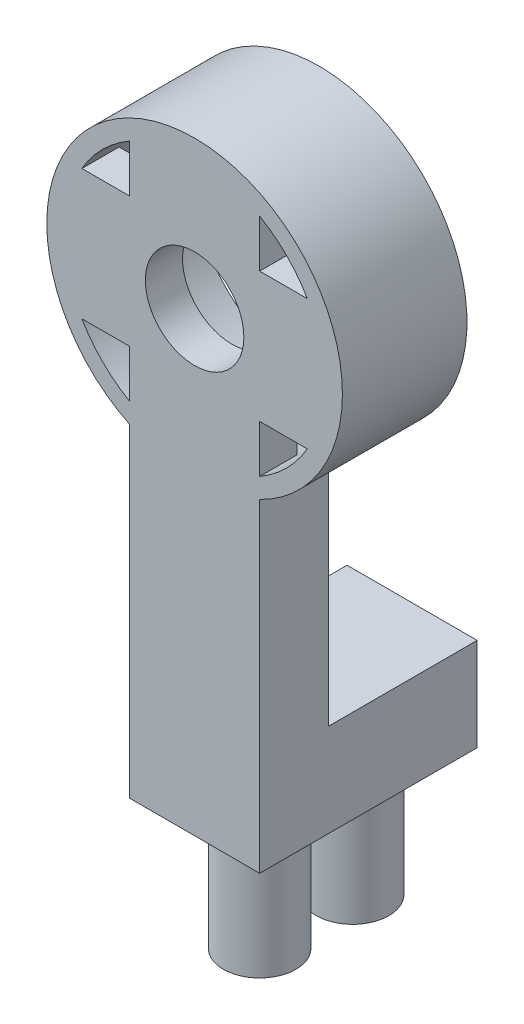
from build123d import *
from build123d.topology import SkipClean

# Parameters (mm, degrees)
SKETCH1_R            = 1.5
BOSS_EXTRUDE4_DEPTH  = 3
BOSS_EXTRUDE5_START  = 3
SKETCH3_R            = 7.95
SKETCH3_R_2          = 1.5
BOSS_EXTRUDE5_DEPTH  = 3
SKETCH4_R            = 2.5
CUT_EXTRUDE1_DEPTH   = 1.5
SKETCH5_R            = 7
CUT_EXTRUDE2_DEPTH   = 4
SKETCH6_R            = 7.95
CUT_EXTRUDE3_DEPTH   = 1
SKETCH7_R            = 2.5
CUT_EXTRUDE4_DEPTH   = 0.5
BOSS_EXTRUDE6_START  = 0.7
SKETCH8_R            = 7.95
SKETCH8_R_2          = 7
BOSS_EXTRUDE6_DEPTH  = 0.7
BOSS_EXTRUDE8_START  = 0.7
SKETCH9_R            = 7.95
SKETCH9_R_2          = 1.5
BOSS_EXTRUDE8_DEPTH  = 0.7
BOSS_EXTRUDE9_START  = 0.7
BOSS_EXTRUDE9_DEPTH  = 0.7
SKETCH15_R           = 7
SKETCH15_R_2         = 4.949747468
BOSS_EXTRUDE12_DEPTH = 5.7
SKETCH16_W           = 7
SKETCH16_H           = 7
CUT_EXTRUDE7_DEPTH   = 5.7
SKETCH17_W           = 21.103619628
SKETCH17_H           = 19.457314619
CUT_EXTRUDE8_DEPTH   = 10
SKETCH18_W           = 7
SKETCH18_H           = 8
BOSS_EXTRUDE13_DEPTH = 5
SKETCH19_R           = 1.95
BOSS_EXTRUDE14_DEPTH = 7
SKETCH20_R           = 2.65
CUT_EXTRUDE9_DEPTH   = 10


with BuildPart() as part:
    # Sketch1 → Boss-Extrude4 (new body)
    with BuildSketch(Plane.XY):
        with BuildLine():
            Line((-3.5, -7.138101989), (-3.5, -27.861898011))
            ThreePointArc((-3.5, -27.861898011), (0, -42.95), (3.5, -27.861898011))
            Line((3.5, -27.861898011), (3.5, -7.138101989))
            ThreePointArc((3.5, -7.138101989), (0, 7.95), (-3.5, -7.138101989))
        make_face()
        with BuildLine():
            Line((-3.5, 6.062177826), (-3.5, 3.5))
            Line((-3.5, 3.5), (-6.062177826, 3.5))
            ThreePointArc((-6.062177826, 3.5), (-4.949747468, 4.949747468), (-3.5, 6.062177826))
        make_face(mode=Mode.SUBTRACT)
        with BuildLine():
            Line((3.5, 3.5), (3.5, 6.062177826))
            ThreePointArc((3.5, 6.062177826), (4.949747468, 4.949747468), (6.062177826, 3.5))
            Line((6.062177826, 3.5), (3.5, 3.5))
        make_face(mode=Mode.SUBTRACT)
        Circle(SKETCH1_R, mode=Mode.SUBTRACT)
        with BuildLine():
            Line((-6.062177826, -3.5), (-3.5, -3.5))
            Line((-3.5, -3.5), (-3.5, -6.062177826))
            ThreePointArc((-3.5, -6.062177826), (-4.949747468, -4.949747468), (-6.062177826, -3.5))
        make_face(mode=Mode.SUBTRACT)
        with BuildLine():
            Line((3.5, -3.5), (6.062177826, -3.5))
            ThreePointArc((6.062177826, -3.5), (4.949747468, -4.949747468), (3.5, -6.062177826))
            Line((3.5, -6.062177826), (3.5, -3.5))
        make_face(mode=Mode.SUBTRACT)
        with BuildLine():
            ThreePointArc((3.5, -28.937822174), (4.949747468, -30.050252532), (6.062177826, -31.5))
            Line((6.062177826, -31.5), (3.5, -31.5))
            Line((3.5, -31.5), (3.5, -28.937822174))
        make_face(mode=Mode.SUBTRACT)
        with BuildLine():
            Line((-3.5, -28.937822174), (-3.5, -31.5))
            Line((-3.5, -31.5), (-6.062177826, -31.5))
            ThreePointArc((-6.062177826, -31.5), (-4.949747468, -30.050252532), (-3.5, -28.937822174))
        make_face(mode=Mode.SUBTRACT)
        with BuildLine():
            ThreePointArc((-3.5, -41.062177826), (-4.949747468, -39.949747468), (-6.062177826, -38.5))
            Line((-6.062177826, -38.5), (-3.5, -38.5))
            Line((-3.5, -38.5), (-3.5, -41.062177826))
        make_face(mode=Mode.SUBTRACT)
        with BuildLine():
            ThreePointArc((6.062177826, -38.5), (4.949747468, -39.949747468), (3.5, -41.062177826))
            Line((3.5, -41.062177826), (3.5, -38.5))
            Line((3.5, -38.5), (6.062177826, -38.5))
        make_face(mode=Mode.SUBTRACT)
        with Locations((0, -35)):
            Circle(SKETCH1_R, mode=Mode.SUBTRACT)
    extrude(amount=BOSS_EXTRUDE4_DEPTH)

    # Sketch3 → Boss-Extrude5 (add)
    # profile 1 of 2: a face of its own
    with SkipClean():  # the faces are left unmerged after this step: merging them gives an invalid solid
        with BuildSketch(Plane(origin=(0, 0, 0), x_dir=(-1, 0, 0), z_dir=(0, 0, -1)).offset(BOSS_EXTRUDE5_START)):
            Circle(SKETCH3_R)
            with BuildLine():
                Line((3.5, 3.5), (3.5, 6.062177826))
                ThreePointArc((3.5, 6.062177826), (4.949747468, 4.949747468), (6.062177826, 3.5))
                Line((6.062177826, 3.5), (3.5, 3.5))
            make_face(mode=Mode.SUBTRACT)
            with BuildLine():
                Line((3.5, -3.5), (6.062177826, -3.5))
                ThreePointArc((6.062177826, -3.5), (4.949747468, -4.949747468), (3.5, -6.062177826))
                Line((3.5, -6.062177826), (3.5, -3.5))
            make_face(mode=Mode.SUBTRACT)
            with BuildLine():
                Line((-3.5, -3.5), (-3.5, -6.062177826))
                ThreePointArc((-3.5, -6.062177826), (-4.949747468, -4.949747468), (-6.062177826, -3.5))
                Line((-6.062177826, -3.5), (-3.5, -3.5))
            make_face(mode=Mode.SUBTRACT)
            with BuildLine():
                Line((-3.5, 3.5), (-6.062177826, 3.5))
                ThreePointArc((-6.062177826, 3.5), (-4.949747468, 4.949747468), (-3.5, 6.062177826))
                Line((-3.5, 6.062177826), (-3.5, 3.5))
            make_face(mode=Mode.SUBTRACT)
            Circle(SKETCH3_R_2, mode=Mode.SUBTRACT)
        # profile 2 of 2: a face of its own
        with BuildSketch(Plane(origin=(0, 0, 0), x_dir=(-1, 0, 0), z_dir=(0, 0, -1)).offset(BOSS_EXTRUDE5_START)):
            with Locations((0, -35)):
                Circle(SKETCH3_R)
            with BuildLine():
                Line((-3.5, -38.5), (-3.5, -41.062177826))
                ThreePointArc((-3.5, -41.062177826), (-4.949747468, -39.949747468), (-6.062177826, -38.5))
                Line((-6.062177826, -38.5), (-3.5, -38.5))
            make_face(mode=Mode.SUBTRACT)
            with BuildLine():
                Line((-3.5, -31.5), (-6.062177826, -31.5))
                ThreePointArc((-6.062177826, -31.5), (-4.949747468, -30.050252532), (-3.5, -28.937822174))
                Line((-3.5, -28.937822174), (-3.5, -31.5))
            make_face(mode=Mode.SUBTRACT)
            with BuildLine():
                Line((3.5, -31.5), (3.5, -28.937822174))
                ThreePointArc((3.5, -28.937822174), (4.949747468, -30.050252532), (6.062177826, -31.5))
                Line((6.062177826, -31.5), (3.5, -31.5))
            make_face(mode=Mode.SUBTRACT)
            with BuildLine():
                Line((3.5, -38.5), (6.062177826, -38.5))
                ThreePointArc((6.062177826, -38.5), (4.949747468, -39.949747468), (3.5, -41.062177826))
                Line((3.5, -41.062177826), (3.5, -38.5))
            make_face(mode=Mode.SUBTRACT)
            with Locations((0, -35)):
                Circle(SKETCH3_R_2, mode=Mode.SUBTRACT)
        extrude(amount=-BOSS_EXTRUDE5_DEPTH)

    # Sketch4 → Cut-Extrude1 (cut)
    with SkipClean():  # the faces are left unmerged after this step: merging them gives an invalid solid
        with BuildSketch(Plane.XY.offset(3)):
            with Locations((0, -35)):
                Circle(SKETCH4_R)
            Circle(SKETCH4_R)
        extrude(amount=-CUT_EXTRUDE1_DEPTH, mode=Mode.SUBTRACT)

    # Sketch5 → Cut-Extrude2 (cut)
    with SkipClean():  # the faces are left unmerged after this step: merging them gives an invalid solid
        with BuildSketch(Plane(origin=(0, 0, -3), x_dir=(-1, 0, 0), z_dir=(0, 0, -1))):
            Circle(SKETCH5_R)
        extrude(amount=-CUT_EXTRUDE2_DEPTH, mode=Mode.SUBTRACT)
    add(part.part.scale(1), mode=Mode.REPLACE)  # the faces are merged on a copy

    # Sketch6 → Cut-Extrude3 (cut)
    with BuildSketch(Plane(origin=(0, 0, -3), x_dir=(-1, 0, 0), z_dir=(0, 0, -1))):
        with Locations((0, -35)):
            Circle(SKETCH6_R)
    extrude(amount=-CUT_EXTRUDE3_DEPTH, mode=Mode.SUBTRACT)

    # Sketch7 → Cut-Extrude4 (cut)
    with BuildSketch(Plane.XY.offset(1.5)):
        with Locations((0, -35)):
            Circle(SKETCH7_R)
    extrude(amount=-CUT_EXTRUDE4_DEPTH, mode=Mode.SUBTRACT)

    # Sketch8 → Boss-Extrude6 (add)
    with BuildSketch(Plane(origin=(0, 0, -3), x_dir=(-1, 0, 0), z_dir=(0, 0, -1)).offset(BOSS_EXTRUDE6_START)):
        Circle(SKETCH8_R)
        Circle(SKETCH8_R_2, mode=Mode.SUBTRACT)
    extrude(amount=-BOSS_EXTRUDE6_DEPTH)

    # Sketch9 → Boss-Extrude8 (add)
    with SkipClean():  # the faces are left unmerged after this step: merging them gives an invalid solid
        with BuildSketch(Plane(origin=(0, 0, -2), x_dir=(-1, 0, 0), z_dir=(0, 0, -1)).offset(BOSS_EXTRUDE8_START)):
            with Locations((0, -35)):
                Circle(SKETCH9_R)
            with BuildLine():
                Line((3.5, -31.5), (3.5, -28.937822174))
                ThreePointArc((3.5, -28.937822174), (4.949747468, -30.050252532), (6.062177826, -31.5))
                Line((6.062177826, -31.5), (3.5, -31.5))
            make_face(mode=Mode.SUBTRACT)
            with BuildLine():
                Line((3.5, -38.5), (6.062177826, -38.5))
                ThreePointArc((6.062177826, -38.5), (4.949747468, -39.949747468), (3.5, -41.062177826))
                Line((3.5, -41.062177826), (3.5, -38.5))
            make_face(mode=Mode.SUBTRACT)
            with BuildLine():
                Line((-3.5, -38.5), (-3.5, -41.062177826))
                ThreePointArc((-3.5, -41.062177826), (-4.949747468, -39.949747468), (-6.062177826, -38.5))
                Line((-6.062177826, -38.5), (-3.5, -38.5))
            make_face(mode=Mode.SUBTRACT)
            with BuildLine():
                Line((-3.5, -31.5), (-6.062177826, -31.5))
                ThreePointArc((-6.062177826, -31.5), (-4.949747468, -30.050252532), (-3.5, -28.937822174))
                Line((-3.5, -28.937822174), (-3.5, -31.5))
            make_face(mode=Mode.SUBTRACT)
            with Locations((0, -35)):
                Circle(SKETCH9_R_2, mode=Mode.SUBTRACT)
        extrude(amount=-BOSS_EXTRUDE8_DEPTH)

    # Sketch10 → Boss-Extrude9 (add)
    with SkipClean():  # the faces are left unmerged after this step: merging them gives an invalid solid
        with BuildSketch(Plane(origin=(0, 0, 0), x_dir=(-1, 0, 0), z_dir=(0, 0, -1)).offset(BOSS_EXTRUDE9_START)):
            with BuildLine():
                ThreePointArc((3.5, -7.138101989), (0, -7.95), (-3.5, -7.138101989))
                Line((-3.5, -7.138101989), (-3.5, -27.861898011))
                ThreePointArc((-3.5, -27.861898011), (0, -27.05), (3.5, -27.861898011))
                Line((3.5, -27.861898011), (3.5, -7.138101989))
            make_face()
        extrude(amount=-BOSS_EXTRUDE9_DEPTH)

    # Sketch15 → Boss-Extrude12 (add)
    with SkipClean():  # the faces are left unmerged after this step: merging them gives an invalid solid
        with BuildSketch(Plane(origin=(0, 0, -2.7), x_dir=(-1, 0, 0), z_dir=(0, 0, -1))):
            with Locations((0, -35)):
                Circle(SKETCH15_R)
            with Locations((0, -35)):
                Circle(SKETCH15_R_2, mode=Mode.SUBTRACT)
        extrude(amount=-BOSS_EXTRUDE12_DEPTH)

    # Sketch16 → Cut-Extrude7 (cut)
    with SkipClean():  # the faces are left unmerged after this step: merging them gives an invalid solid
        with BuildSketch(Plane(origin=(0, 0, -2.7), x_dir=(-1, 0, 0), z_dir=(0, 0, -1))):
            with Locations((0, -35)):
                Rectangle(SKETCH16_W, SKETCH16_H)
        extrude(amount=-CUT_EXTRUDE7_DEPTH, mode=Mode.SUBTRACT)

    # Sketch17 → Cut-Extrude8 (cut)
    with SkipClean():  # the faces are left unmerged after this step: merging them gives an invalid solid
        with BuildSketch(Plane(origin=(0, 0, -2.7), x_dir=(-1, 0, 0), z_dir=(0, 0, -1))):
            with Locations((-0.474648884, -34.27865731)):
                Rectangle(SKETCH17_W, SKETCH17_H)
        extrude(amount=-CUT_EXTRUDE8_DEPTH, mode=Mode.SUBTRACT)

    # Sketch18 → Boss-Extrude13 (add)
    with SkipClean():  # the faces are left unmerged after this step: merging them gives an invalid solid
        with BuildSketch(Plane.XZ.offset(24.55)):
            with Locations((0, -4.7)):
                Rectangle(SKETCH18_W, SKETCH18_H)
        extrude(amount=-BOSS_EXTRUDE13_DEPTH)

    # Sketch19 → Boss-Extrude14 (add)
    with SkipClean():  # the faces are left unmerged after this step: merging them gives an invalid solid
        with BuildSketch(Plane.XZ.offset(24.55)):
            with Locations((0, -5.5)):
                Circle(SKETCH19_R)
            with Locations((0, -0.5)):
                Circle(SKETCH19_R)
        extrude(amount=BOSS_EXTRUDE14_DEPTH)

    # Sketch20 → Cut-Extrude9 (cut)
    with SkipClean():  # the faces are left unmerged after this step: merging them gives an invalid solid
        with BuildSketch(Plane.XY.offset(3)):
            Circle(SKETCH20_R)
        extrude(amount=-CUT_EXTRUDE9_DEPTH, mode=Mode.SUBTRACT)


solid = part.part
